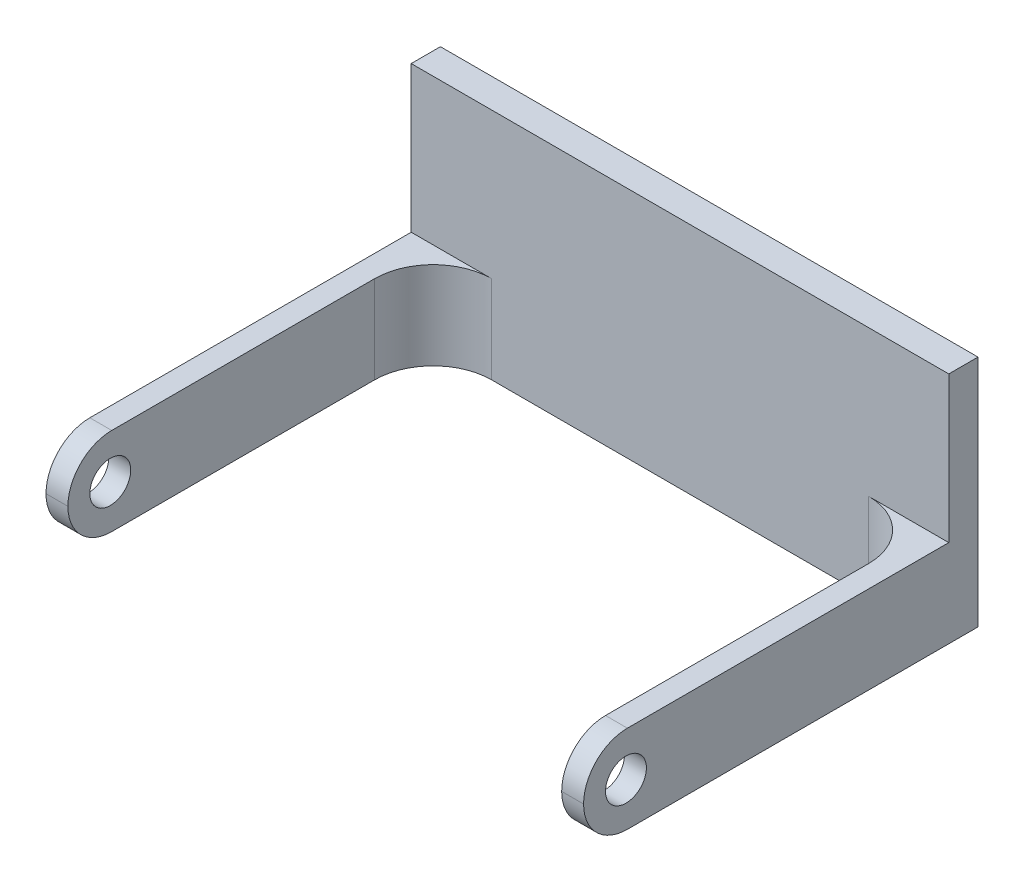
from build123d import *

# Parameters (mm, degrees)
SKETCH1_W           = 36.8
SKETCH1_H           = 6
BOSS_EXTRUDE1_DEPTH = 2
SKETCH2_W           = 1.5
SKETCH2_H           = 6
BOSS_EXTRUDE2_DEPTH = 25
SKETCH3_R           = 1.4
CUT_EXTRUDE1_DEPTH  = 46.741010046
FILLET1_R           = 3
SKETCH4_W           = 36.8
SKETCH4_H           = 2
BOSS_EXTRUDE3_DEPTH = 10
FILLET2_R           = 4


with BuildPart() as part:
    # Sketch1 → Boss-Extrude1 (new body)
    with BuildSketch(Plane.XY):
        Rectangle(SKETCH1_W, SKETCH1_H)
    extrude(amount=BOSS_EXTRUDE1_DEPTH)

    # Sketch2 → Boss-Extrude2 (add)
    with BuildSketch(Plane.XY.offset(2)):
        with Locations((-17.65, 0)):
            Rectangle(SKETCH2_W, SKETCH2_H)
        with Locations((17.65, 0)):
            Rectangle(SKETCH2_W, SKETCH2_H)
    extrude(amount=BOSS_EXTRUDE2_DEPTH)

    # Sketch3 → Cut-Extrude1 (cut, through all)
    with BuildSketch(Plane(origin=(18.4, 0, 0), x_dir=(0, 0, -1), z_dir=(1, 0, 0))):
        with Locations((-24.1, 0)):
            Circle(SKETCH3_R)
    extrude(amount=-CUT_EXTRUDE1_DEPTH, mode=Mode.SUBTRACT)

    # Fillet1
    fillet1_edges = [part.edges().sort_by_distance(p)[0] for p in [
        (-17.65, -3, 27),
        (17.65, -3, 27),
        (-17.65, 3, 27),
        (17.65, 3, 27),
    ]]
    fillet(fillet1_edges, radius=FILLET1_R - 0.0001)  # a hair under: the kernel refuses the full size

    # Sketch4 → Boss-Extrude3 (add)
    with BuildSketch(Plane(origin=(0, 3, 0), x_dir=(1, 0, 0), z_dir=(0, 1, 0))):
        with Locations((0, -1)):
            Rectangle(SKETCH4_W, SKETCH4_H)
    extrude(amount=BOSS_EXTRUDE3_DEPTH)

    # Fillet2
    fillet2_edges = [part.edges().sort_by_distance(p)[0] for p in [
        (16.9, 0, 2),
        (-16.9, 0, 2),
    ]]
    fillet(fillet2_edges, radius=FILLET2_R)


solid = part.part
